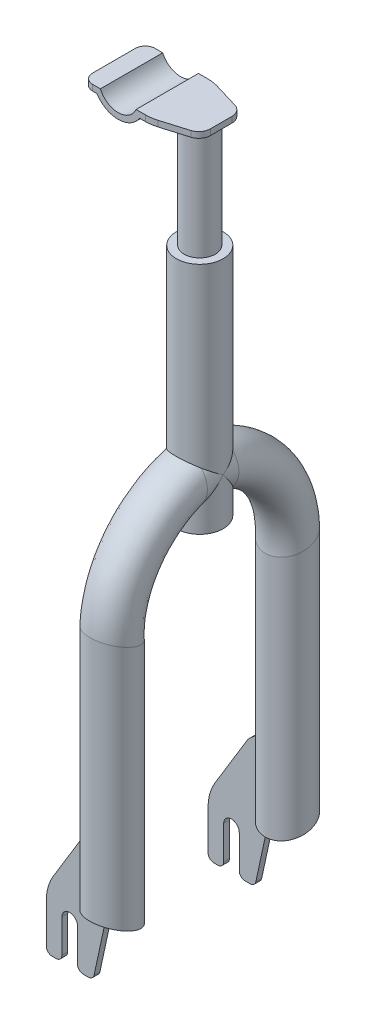
from build123d import *

# Parameters (mm, degrees)
BOSS_EXTRUDE1_DEPTH = 10.16
CUT_EXTRUDE1_START  = -40.64
CUT_EXTRUDE1_DEPTH  = 40.64
SKETCH4_R           = 10.16
BOSS_EXTRUDE2_DEPTH = 224.79
SKETCH6_R           = 15.24
SKETCH8_R           = 15.24
BOSS_EXTRUDE3_DEPTH = 152.4
BOSS_EXTRUDE4_DEPTH = 3.81


# Read off the part's stored shape, not the designer's step: Cut-Extrude1
with BuildPart() as part:
    # Sketch1 → Boss-Extrude1 (new, symmetric)
    with BuildSketch(Plane(origin=(0, 0, 0), x_dir=(1, 0, 0), z_dir=(0, 1, 0))):
        with BuildLine():
            Line((-35.56, 13.97), (-35.56, -13.97))
            ThreePointArc((-35.56, -13.97), (-33.700128061, -18.460128061), (-29.21, -20.32))
            Line((-29.21, -20.32), (5.162071558, -20.32))
            ThreePointArc((5.162071558, -20.32), (8.850485433, -20.050770046), (12.460707851, -19.248787645))
            Line((12.460707851, -19.248787645), (28.859590888, -14.329122734))
            ThreePointArc((28.859590888, -14.329122734), (32.783472114, -11.579097076), (34.29, -7.03048644))
            Line((34.29, -7.03048644), (34.29, 7.03048644))
            ThreePointArc((34.29, 7.03048644), (32.783472114, 11.579097076), (28.859590888, 14.329122734))
            Line((28.859590888, 14.329122734), (12.460707851, 19.248787645))
            ThreePointArc((12.460707851, 19.248787645), (8.850485433, 20.050770046), (5.162071558, 20.32))
            Line((5.162071558, 20.32), (-29.21, 20.32))
            ThreePointArc((-29.21, 20.32), (-33.700128061, 18.460128061), (-35.56, 13.97))
        make_face()
    extrude(amount=BOSS_EXTRUDE1_DEPTH, both=True)

    # Cut-Extrude1 outline → Cut-Extrude1 (cut)
    with BuildSketch(Plane.XY.offset(20.32).offset(CUT_EXTRUDE1_START)):
        with BuildLine():
            ThreePointArc((-24.13, 10.16), (-12.490257735, 2.54), (-0.85051547, 10.16))
            Line((-0.85051547, 10.16), (-24.13, 10.16))
        make_face()
        with BuildLine():
            Line((34.29, -10.16), (34.29, 6.35))
            Line((34.29, 6.35), (1.421895226, 6.35))
            ThreePointArc((1.421895226, 6.35), (-12.490257734, -1.27), (-26.402410695, 6.35))
            Line((-26.402410695, 6.35), (-35.56, 6.35))
            Line((-35.56, 6.35), (-35.56, -10.16))
            Line((-35.56, -10.16), (34.29, -10.16))
        make_face()
    extrude(amount=CUT_EXTRUDE1_DEPTH, mode=Mode.SUBTRACT)

    # Sketch4 → Boss-Extrude2 (add)
    with BuildSketch(Plane.XZ.offset(-6.35)):
        with Locations(Location((20.32, 0, 0), (0, 0, 90))):
            Circle(SKETCH4_R)
    extrude(amount=BOSS_EXTRUDE2_DEPTH)

    # Sweep1: sweep along a path in Sketch5
    with BuildLine(Plane(origin=(20.32, 0, 0), x_dir=(0, 0, -1), z_dir=(1, 0, 0))) as sweep1_path:
        Line((0, -187.96), (-10.257119372, -191.379078185))
        ThreePointArc((-10.257119372, -191.379078185), (-44.205056603, -216.340368095), (-57.15, -256.439705705))
        Line((-57.15, -256.439705705), (-57.15, -416.56))
    # Sketch6 → Sweep1 (sweep)
    with BuildSketch(Plane.XY):
        with Locations((20.32, -187.96)):
            Circle(SKETCH6_R)
    sweep1 = sweep(path=sweep1_path.line)

    # Mirror1: Sweep1 across plane
    add(sweep1.mirror(Plane.XY))

    # Sketch8 → Boss-Extrude3 (add)
    with BuildSketch(Plane.XZ.offset(218.44)):
        with Locations(Location((20.32, 0, 0), (0, 0, 270))):
            Circle(SKETCH8_R)
    extrude(amount=-BOSS_EXTRUDE3_DEPTH)


with BuildPart() as body_2:
    # Sketch10 → Boss-Extrude4 (new body)
    with BuildSketch(Plane.XY.offset(50.8)):
        with BuildLine():
            Line((11.120306365, -370.624285258), (2.249495067, -378.571053712))
            ThreePointArc((2.249495067, -378.571053712), (1.011388199, -379.897771326), (0.029049672, -381.423582343))
            Line((0.029049672, -381.423582343), (-20.625451281, -415.398754117))
            ThreePointArc((-20.625451281, -415.398754117), (-23.930889958, -423.010738309), (-25.060618111, -431.232170209))
            Line((-25.060618111, -431.232170209), (-25.060618111, -456.984285258))
            ThreePointArc((-25.060618111, -456.984285258), (-23.944694947, -459.678362094), (-21.250618111, -460.794285258))
            Line((-21.250618111, -460.794285258), (-18.710618111, -460.794285258))
            ThreePointArc((-18.710618111, -460.794285258), (-16.016541275, -459.678362094), (-14.900618111, -456.984285258))
            Line((-14.900618111, -456.984285258), (-14.900618111, -435.394285258))
            ThreePointArc((-14.900618111, -435.394285258), (-9.820618111, -430.314285258), (-4.740618111, -435.394285258))
            Line((-4.740618111, -435.394285258), (-4.740618111, -456.984285258))
            ThreePointArc((-4.740618111, -456.984285258), (-3.624694947, -459.678362094), (-0.930618111, -460.794285258))
            Line((-0.930618111, -460.794285258), (2.343653237, -460.794285258))
            ThreePointArc((2.343653237, -460.794285258), (4.73687397, -459.948841636), (6.067977536, -457.787720702))
            Line((6.067977536, -457.787720702), (14.295306365, -419.649945096))
            Line((14.295306365, -419.649945096), (11.120306365, -418.169418281))
            Line((11.120306365, -418.169418281), (11.120306365, -370.624285258))
        make_face()
    extrude(amount=BOSS_EXTRUDE4_DEPTH)


with BuildPart() as body_3:
    # Mirror2: mirrored copy
    add(body_2.part.mirror(Plane.XY))


solid = Compound([part.part, body_2.part, body_3.part])
